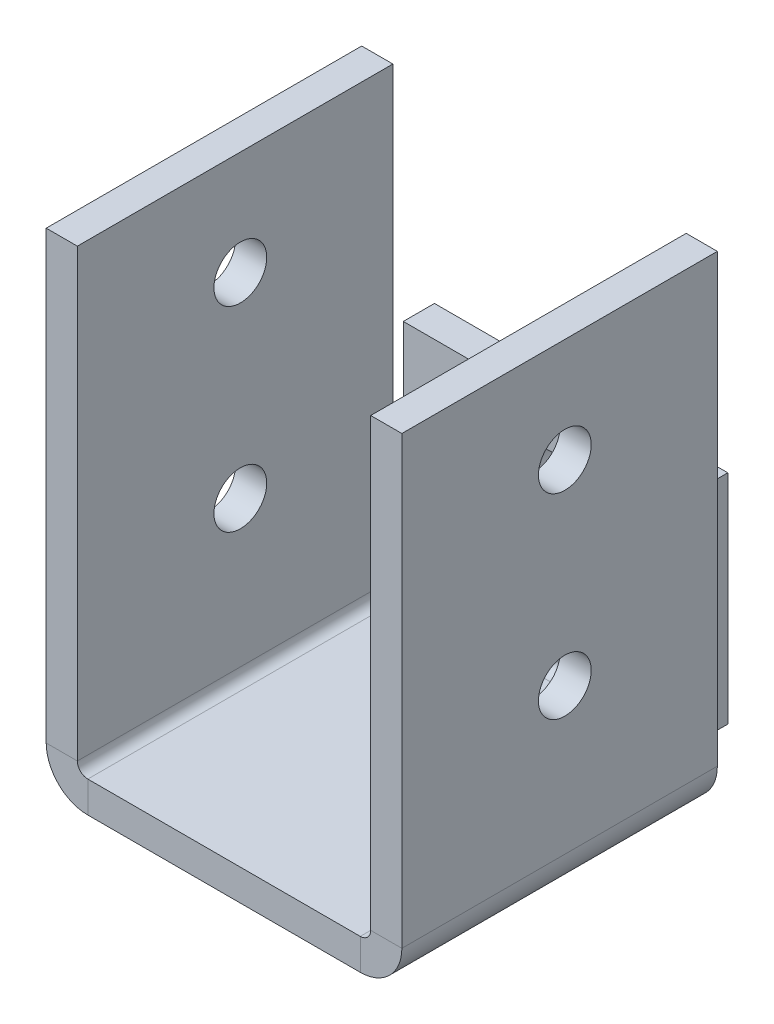
from build123d import *

# Parameters (mm, degrees)
SKETCH2_W                    = 45
SKETCH2_H                    = 50
BASE_FLANGE1_DEPTH           = 4.78
EDGE_FLANGE1_STRIP_W         = 22.32
EDGE_FLANGE1_STRIP_H         = 4.78
EDGE_FLANGE1_STRIP_CUT_DEPTH = 45
EDGE_FLANGE1_DEPTH           = 45
EDGE_FLANGE2_START           = -29.78
EDGE_FLANGE2_OUTLINE_W       = 1.6
EDGE_FLANGE2_OUTLINE_H       = 6.38
EDGE_FLANGE2_DEPTH           = 6.38
EDGE_FLANGE2_START_2         = -23.4
EDGE_FLANGE2_2_DEPTH         = 48.4
EDGE_FLANGE2_3_DEPTH         = 48.4
CUT_EXTRUDE1_REACH           = 95.614
SKETCH23_R                   = 4.05
SKETCH24_R                   = 4.05
CUT_EXTRUDE2_DEPTH           = 4.78


# Read off the part's stored shape, not the designer's step: Edge-Flange2
# Sheet-metal steps are written as plain solids
with BuildPart() as part:
    # Sketch2 → Base-Flange1 (new body)
    with BuildSketch(Plane(origin=(0, 0, 0), x_dir=(1, 0, 0), z_dir=(0, 1, 0))):
        Rectangle(SKETCH2_W, SKETCH2_H)
    extrude(amount=-BASE_FLANGE1_DEPTH)

    # Edge-Flange1 strip (across the edge) → Edge-Flange1 strip cut (cut)
    with BuildSketch(Plane(origin=(22.5, 0, -25), x_dir=(0, 0, 1), z_dir=(-1, 0, 0))):
        with Locations((-9.56, -2.39)):
            Rectangle(EDGE_FLANGE1_STRIP_W, EDGE_FLANGE1_STRIP_H)
    extrude(amount=EDGE_FLANGE1_STRIP_CUT_DEPTH, mode=Mode.SUBTRACT)

    # Edge-Flange1 section (across the edge) → Edge-Flange1 (add)
    with BuildSketch(Plane(origin=(22.5, 0, -25), x_dir=(0, 0, 1), z_dir=(-1, 0, 0))):
        with BuildLine():
            Line((-4.78, 1.6), (-4.78, 35))
            Line((-4.78, 35), (0, 35))
            Line((0, 35), (0, 1.6))
            ThreePointArc((0, 1.6), (0.46862915, 0.46862915), (1.6, 0))
            Line((1.6, 0), (1.6, -4.78))
            ThreePointArc((1.6, -4.78), (-2.911341264, -2.911341264), (-4.78, 1.6))
        make_face()
    extrude(amount=EDGE_FLANGE1_DEPTH)

    # Edge-Flange2 outline → Edge-Flange2 (cut)
    with BuildSketch(Plane.XY.offset(EDGE_FLANGE2_START)):
        with Locations((-21.7, -1.59)):
            Rectangle(EDGE_FLANGE2_OUTLINE_W, EDGE_FLANGE2_OUTLINE_H)
        with Locations((21.7, -1.59)):
            Rectangle(EDGE_FLANGE2_OUTLINE_W, EDGE_FLANGE2_OUTLINE_H)
    extrude(amount=EDGE_FLANGE2_DEPTH, mode=Mode.SUBTRACT)

    # Edge-Flange2 2 outline → Edge-Flange2 2 (cut)
    with BuildSketch(Plane.XY.offset(EDGE_FLANGE2_START_2)):
        with BuildLine():
            Line((-22.5, -4.78), (-20.9, -4.78))
            ThreePointArc((-20.9, -4.78), (-21.706468998, -4.728823568), (-22.5, -4.576115284))
            Line((-22.5, -4.576115284), (-22.5, -4.78))
        make_face()
        with BuildLine():
            ThreePointArc((22.5, -4.576115284), (21.706468998, -4.728823568), (20.9, -4.78))
            Line((20.9, -4.78), (22.5, -4.78))
            Line((22.5, -4.78), (22.5, -4.576115284))
        make_face()
    extrude(amount=EDGE_FLANGE2_2_DEPTH, mode=Mode.SUBTRACT)

    # Edge-Flange2 3 outline → Edge-Flange2 3 (add)
    with BuildSketch(Plane.XY.offset(EDGE_FLANGE2_START_2)):
        with BuildLine():
            Line((-22.5, -4.576115284), (-22.5, 0))
            Line((-22.5, 0), (-20.9, 0))
            ThreePointArc((-20.9, 0), (-22.03137085, 0.46862915), (-22.5, 1.6))
            Line((-22.5, 1.6), (-22.5, 70))
            Line((-22.5, 70), (-27.28, 70))
            Line((-27.28, 70), (-27.28, 1.6))
            ThreePointArc((-27.28, 1.6), (-25.945413759, -2.304894365), (-22.5, -4.576115284))
        make_face()
        with BuildLine():
            ThreePointArc((22.5, 1.6), (22.03137085, 0.46862915), (20.9, 0))
            Line((20.9, 0), (22.5, 0))
            Line((22.5, 0), (22.5, -4.576115284))
            ThreePointArc((22.5, -4.576115284), (25.945413759, -2.304894365), (27.28, 1.6))
            Line((27.28, 1.6), (27.28, 70))
            Line((27.28, 70), (22.5, 70))
            Line((22.5, 70), (22.5, 1.6))
        make_face()
    extrude(amount=EDGE_FLANGE2_3_DEPTH)

    # Cut-Extrude1: up to this face of the body (flat: up to its plane)
    cut_extrude1_end = Plane(part.part.faces().sort_by_distance((-27.28, 35.8, 0.8))[0])
    # Sketch23 → Cut-Extrude1 (cut, up to the picked face)
    with BuildSketch(Plane(origin=(27.28, 0, 0), x_dir=(0, 0, -1), z_dir=(1, 0, 0)), mode=Mode.PRIVATE) as cut_extrude1_sk1:
        with Locations(Location((0, 54, 0), (0, 0, 90))):
            Circle(SKETCH23_R)
    cut_extrude1_tool1 = split(extrude(cut_extrude1_sk1.sketch, amount=-CUT_EXTRUDE1_REACH, mode=Mode.PRIVATE), bisect_by=cut_extrude1_end, keep=Keep.BOTH, mode=Mode.PRIVATE)
    # Sketch23 → Cut-Extrude1 (cut, up to the picked face)
    with BuildSketch(Plane(origin=(27.28, 0, 0), x_dir=(0, 0, -1), z_dir=(1, 0, 0)), mode=Mode.PRIVATE) as cut_extrude1_sk2:
        with Locations(Location((0, 24, 0), (0, 0, 90))):
            Circle(SKETCH23_R)
    cut_extrude1_tool2 = split(extrude(cut_extrude1_sk2.sketch, amount=-CUT_EXTRUDE1_REACH, mode=Mode.PRIVATE), bisect_by=cut_extrude1_end, keep=Keep.BOTH, mode=Mode.PRIVATE)
    add(cut_extrude1_tool1.solids().sort_by(Axis((27.28, 54, 0), (-1, 0, 0)))[0], mode=Mode.SUBTRACT)
    add(cut_extrude1_tool2.solids().sort_by(Axis((27.28, 24, 0), (-1, 0, 0)))[0], mode=Mode.SUBTRACT)

    # Sketch24 → Cut-Extrude2 (cut)
    with BuildSketch(Plane(origin=(0, 0, -29.78), x_dir=(-1, 0, 0), z_dir=(0, 0, -1))):
        with Locations(Location((0, 25, 0), (0, 0, 90))):
            Circle(SKETCH24_R)
        with Locations(Location((0, 10, 0), (0, 0, 90))):
            Circle(SKETCH24_R)
    extrude(amount=-CUT_EXTRUDE2_DEPTH, mode=Mode.SUBTRACT)


solid = part.part
